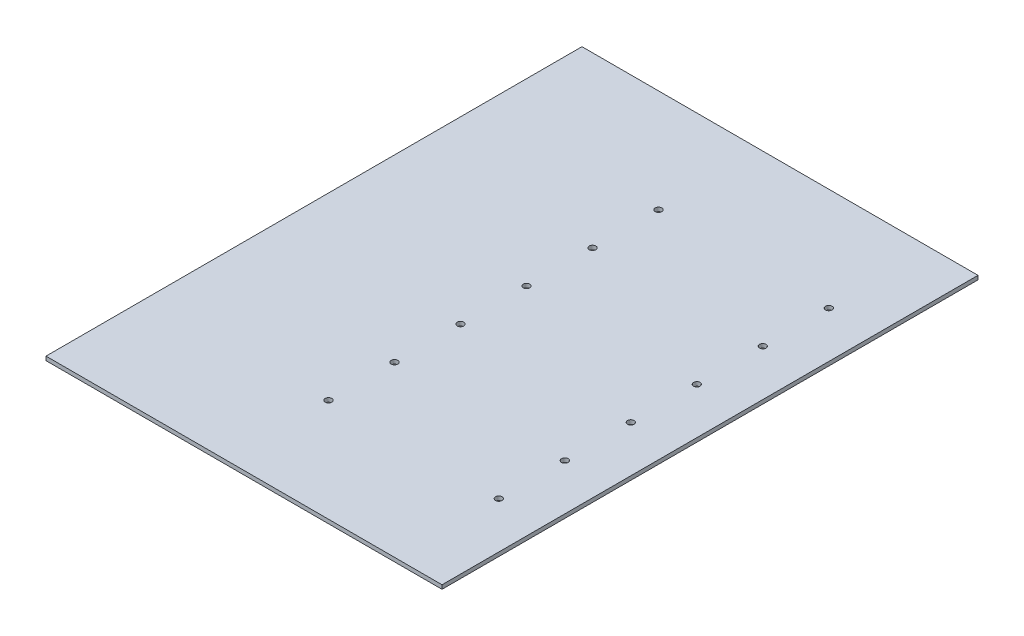
from build123d import *

# Parameters (mm, degrees)
SKETCH1_W           = 300
SKETCH1_H           = 406
BOSS_EXTRUDE1_DEPTH = 3
CUT_EXTRUDE1_REACH  = 254.424
SKETCH2_R           = 2.5


with BuildPart() as part:
    # Sketch1 → Boss-Extrude1 (new body)
    with BuildSketch(Plane(origin=(0, 0, 0), x_dir=(1, 0, 0), z_dir=(0, 1, 0))):
        Rectangle(SKETCH1_W, SKETCH1_H)
    extrude(amount=BOSS_EXTRUDE1_DEPTH)

    # Sketch2 → Cut-Extrude1 (cut, up to next)
    with BuildSketch(Plane(origin=(0, 3, 0), x_dir=(1, 0, 0), z_dir=(0, 1, 0)), mode=Mode.PRIVATE) as cut_extrude1_sk1:
        with Locations((115, 125)):
            Circle(SKETCH2_R)
    cut_extrude1_tool1 = extrude(cut_extrude1_sk1.sketch, amount=-CUT_EXTRUDE1_REACH, mode=Mode.PRIVATE) & part.part
    # Sketch2 → Cut-Extrude1 (cut, up to next)
    with BuildSketch(Plane(origin=(0, 3, 0), x_dir=(1, 0, 0), z_dir=(0, 1, 0)), mode=Mode.PRIVATE) as cut_extrude1_sk2:
        with Locations((115, 75)):
            Circle(SKETCH2_R)
    cut_extrude1_tool2 = extrude(cut_extrude1_sk2.sketch, amount=-CUT_EXTRUDE1_REACH, mode=Mode.PRIVATE) & part.part
    # Sketch2 → Cut-Extrude1 (cut, up to next)
    with BuildSketch(Plane(origin=(0, 3, 0), x_dir=(1, 0, 0), z_dir=(0, 1, 0)), mode=Mode.PRIVATE) as cut_extrude1_sk3:
        with Locations((115, 25)):
            Circle(SKETCH2_R)
    cut_extrude1_tool3 = extrude(cut_extrude1_sk3.sketch, amount=-CUT_EXTRUDE1_REACH, mode=Mode.PRIVATE) & part.part
    # Sketch2 → Cut-Extrude1 (cut, up to next)
    with BuildSketch(Plane(origin=(0, 3, 0), x_dir=(1, 0, 0), z_dir=(0, 1, 0)), mode=Mode.PRIVATE) as cut_extrude1_sk4:
        with Locations((115, -25)):
            Circle(SKETCH2_R)
    cut_extrude1_tool4 = extrude(cut_extrude1_sk4.sketch, amount=-CUT_EXTRUDE1_REACH, mode=Mode.PRIVATE) & part.part
    # Sketch2 → Cut-Extrude1 (cut, up to next)
    with BuildSketch(Plane(origin=(0, 3, 0), x_dir=(1, 0, 0), z_dir=(0, 1, 0)), mode=Mode.PRIVATE) as cut_extrude1_sk5:
        with Locations((115, -75)):
            Circle(SKETCH2_R)
    cut_extrude1_tool5 = extrude(cut_extrude1_sk5.sketch, amount=-CUT_EXTRUDE1_REACH, mode=Mode.PRIVATE) & part.part
    # Sketch2 → Cut-Extrude1 (cut, up to next)
    with BuildSketch(Plane(origin=(0, 3, 0), x_dir=(1, 0, 0), z_dir=(0, 1, 0)), mode=Mode.PRIVATE) as cut_extrude1_sk6:
        with Locations((115, -125)):
            Circle(SKETCH2_R)
    cut_extrude1_tool6 = extrude(cut_extrude1_sk6.sketch, amount=-CUT_EXTRUDE1_REACH, mode=Mode.PRIVATE) & part.part
    # Sketch2 → Cut-Extrude1 (cut, up to next)
    with BuildSketch(Plane(origin=(0, 3, 0), x_dir=(1, 0, 0), z_dir=(0, 1, 0)), mode=Mode.PRIVATE) as cut_extrude1_sk7:
        with Locations((-14, 125)):
            Circle(SKETCH2_R)
    cut_extrude1_tool7 = extrude(cut_extrude1_sk7.sketch, amount=-CUT_EXTRUDE1_REACH, mode=Mode.PRIVATE) & part.part
    # Sketch2 → Cut-Extrude1 (cut, up to next)
    with BuildSketch(Plane(origin=(0, 3, 0), x_dir=(1, 0, 0), z_dir=(0, 1, 0)), mode=Mode.PRIVATE) as cut_extrude1_sk8:
        with Locations((-14, 75)):
            Circle(SKETCH2_R)
    cut_extrude1_tool8 = extrude(cut_extrude1_sk8.sketch, amount=-CUT_EXTRUDE1_REACH, mode=Mode.PRIVATE) & part.part
    # Sketch2 → Cut-Extrude1 (cut, up to next)
    with BuildSketch(Plane(origin=(0, 3, 0), x_dir=(1, 0, 0), z_dir=(0, 1, 0)), mode=Mode.PRIVATE) as cut_extrude1_sk9:
        with Locations((-14, 25)):
            Circle(SKETCH2_R)
    cut_extrude1_tool9 = extrude(cut_extrude1_sk9.sketch, amount=-CUT_EXTRUDE1_REACH, mode=Mode.PRIVATE) & part.part
    # Sketch2 → Cut-Extrude1 (cut, up to next)
    with BuildSketch(Plane(origin=(0, 3, 0), x_dir=(1, 0, 0), z_dir=(0, 1, 0)), mode=Mode.PRIVATE) as cut_extrude1_sk10:
        with Locations((-14, -25)):
            Circle(SKETCH2_R)
    cut_extrude1_tool10 = extrude(cut_extrude1_sk10.sketch, amount=-CUT_EXTRUDE1_REACH, mode=Mode.PRIVATE) & part.part
    # Sketch2 → Cut-Extrude1 (cut, up to next)
    with BuildSketch(Plane(origin=(0, 3, 0), x_dir=(1, 0, 0), z_dir=(0, 1, 0)), mode=Mode.PRIVATE) as cut_extrude1_sk11:
        with Locations((-14, -75)):
            Circle(SKETCH2_R)
    cut_extrude1_tool11 = extrude(cut_extrude1_sk11.sketch, amount=-CUT_EXTRUDE1_REACH, mode=Mode.PRIVATE) & part.part
    # Sketch2 → Cut-Extrude1 (cut, up to next)
    with BuildSketch(Plane(origin=(0, 3, 0), x_dir=(1, 0, 0), z_dir=(0, 1, 0)), mode=Mode.PRIVATE) as cut_extrude1_sk12:
        with Locations((-14, -125)):
            Circle(SKETCH2_R)
    cut_extrude1_tool12 = extrude(cut_extrude1_sk12.sketch, amount=-CUT_EXTRUDE1_REACH, mode=Mode.PRIVATE) & part.part
    add(cut_extrude1_tool1.solids().sort_by_distance((115, 3, -125))[0], mode=Mode.SUBTRACT)
    add(cut_extrude1_tool2.solids().sort_by_distance((115, 3, -75))[0], mode=Mode.SUBTRACT)
    add(cut_extrude1_tool3.solids().sort_by_distance((115, 3, -25))[0], mode=Mode.SUBTRACT)
    add(cut_extrude1_tool4.solids().sort_by_distance((115, 3, 25))[0], mode=Mode.SUBTRACT)
    add(cut_extrude1_tool5.solids().sort_by_distance((115, 3, 75))[0], mode=Mode.SUBTRACT)
    add(cut_extrude1_tool6.solids().sort_by_distance((115, 3, 125))[0], mode=Mode.SUBTRACT)
    add(cut_extrude1_tool7.solids().sort_by_distance((-14, 3, -125))[0], mode=Mode.SUBTRACT)
    add(cut_extrude1_tool8.solids().sort_by_distance((-14, 3, -75))[0], mode=Mode.SUBTRACT)
    add(cut_extrude1_tool9.solids().sort_by_distance((-14, 3, -25))[0], mode=Mode.SUBTRACT)
    add(cut_extrude1_tool10.solids().sort_by_distance((-14, 3, 25))[0], mode=Mode.SUBTRACT)
    add(cut_extrude1_tool11.solids().sort_by_distance((-14, 3, 75))[0], mode=Mode.SUBTRACT)
    add(cut_extrude1_tool12.solids().sort_by_distance((-14, 3, 125))[0], mode=Mode.SUBTRACT)


solid = part.part
